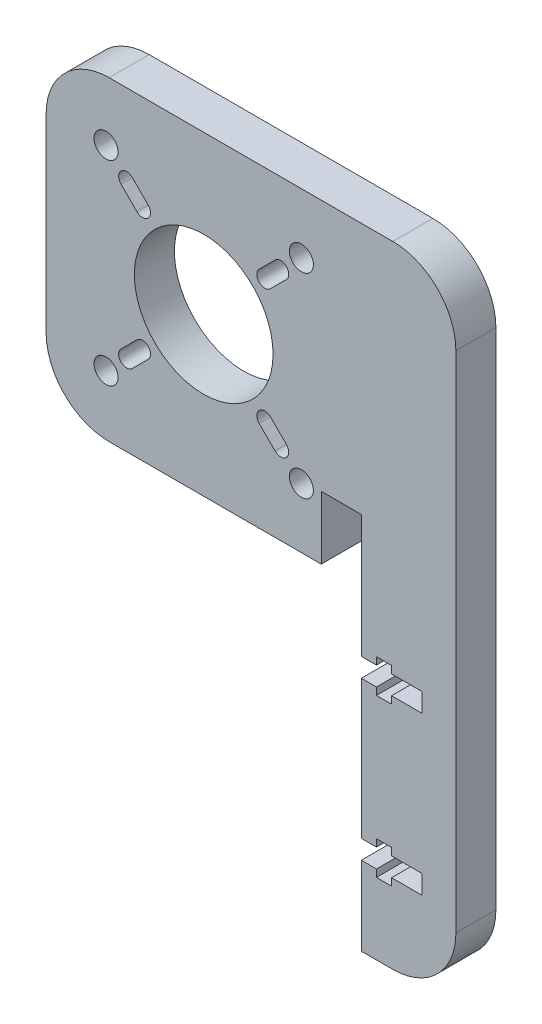
from build123d import *

# Parameters (mm, degrees)
SKETCH1_R           = 1.905
SKETCH1_R_2         = 11
BOSS_EXTRUDE1_DEPTH = 6.35
FILLET1_R           = 10


with BuildPart() as part:
    # Sketch1 → Boss-Extrude1 (new body)
    with BuildSketch(Plane.XY):
        Polygon((18.65, -15), (25, -15), (25, -34.5), (27.4, -34.5), (27.4, -33.34), (29.8, -33.34), (29.8, -34.5), (34.65, -34.5), (34.65, -37.5), (29.8, -37.5), (29.8, -38.66), (27.4, -38.66), (27.4, -37.5), (25, -37.5), (25, -59.5), (27.4, -59.5), (27.4, -58.34), (29.8, -58.34), (29.8, -59.5), (34.65, -59.5), (34.65, -62.5), (29.8, -62.5), (29.8, -63.66), (27.4, -63.66), (27.4, -62.5), (25, -62.5), (25, -75), (40, -75), (40, 25), (-25, 25), (-25, -25), (18.65, -25), align=None)
        with Locations((-15.494, -15.494)):
            Circle(SKETCH1_R, mode=Mode.SUBTRACT)
        with BuildLine():
            ThreePointArc((-11.319365353, -13.115416577), (-13.115416577, -13.115416577), (-13.115416577, -11.319365353))
            Line((-13.115416577, -11.319365353), (-10.600944864, -8.804893639))
            ThreePointArc((-10.600944864, -8.804893639), (-8.804893639, -8.804893639), (-8.804893639, -10.600944864))
            Line((-8.804893639, -10.600944864), (-11.319365353, -13.115416577))
        make_face(mode=Mode.SUBTRACT)
        Circle(SKETCH1_R_2, mode=Mode.SUBTRACT)
        with BuildLine():
            ThreePointArc((-13.115416577, 11.319365353), (-13.115416577, 13.115416577), (-11.319365353, 13.115416577))
            Line((-11.319365353, 13.115416577), (-8.804893639, 10.600944864))
            ThreePointArc((-8.804893639, 10.600944864), (-8.804893639, 8.804893639), (-10.600944864, 8.804893639))
            Line((-10.600944864, 8.804893639), (-13.115416577, 11.319365353))
        make_face(mode=Mode.SUBTRACT)
        with Locations((-15.494, 15.494)):
            Circle(SKETCH1_R, mode=Mode.SUBTRACT)
        with Locations((15.494, -15.494)):
            Circle(SKETCH1_R, mode=Mode.SUBTRACT)
        with BuildLine():
            ThreePointArc((13.115416577, -11.319365353), (13.115416577, -13.115416577), (11.319365353, -13.115416577))
            Line((11.319365353, -13.115416577), (8.804893639, -10.600944864))
            ThreePointArc((8.804893639, -10.600944864), (8.804893639, -8.804893639), (10.600944864, -8.804893639))
            Line((10.600944864, -8.804893639), (13.115416577, -11.319365353))
        make_face(mode=Mode.SUBTRACT)
        with BuildLine():
            ThreePointArc((11.319365353, 13.115416577), (13.115416577, 13.115416577), (13.115416577, 11.319365353))
            Line((13.115416577, 11.319365353), (10.600944864, 8.804893639))
            ThreePointArc((10.600944864, 8.804893639), (8.804893639, 8.804893639), (8.804893639, 10.600944864))
            Line((8.804893639, 10.600944864), (11.319365353, 13.115416577))
        make_face(mode=Mode.SUBTRACT)
        with Locations((15.494, 15.494)):
            Circle(SKETCH1_R, mode=Mode.SUBTRACT)
    extrude(amount=BOSS_EXTRUDE1_DEPTH)

    # Fillet1
    fillet1_edges = [part.edges().sort_by_distance(p)[0] for p in [
        (40, -75, 3.175),
        (40, 25, 3.175),
        (-25, -25, 3.175),
        (-25, 25, 3.175),
    ]]
    fillet(fillet1_edges, radius=FILLET1_R)


solid = part.part
